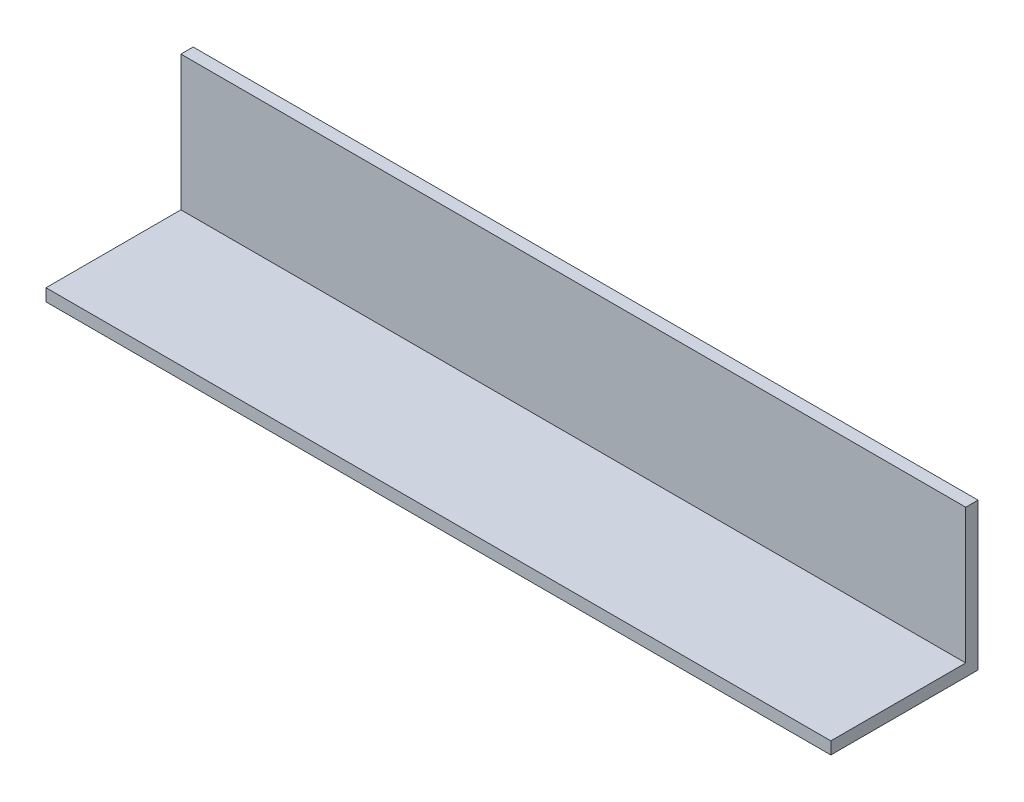
from build123d import *

# Parameters (mm, degrees)
BOSS_EXTRUDE2_DEPTH = 406.4


with BuildPart() as part:
    # Sketch2 → Boss-Extrude2 (new body)
    with BuildSketch(Plane(origin=(0, 0, 0), x_dir=(0, 0, -1), z_dir=(1, 0, 0))):
        Polygon((0, 6.35), (0, 0), (76.2, 0), (76.2, 76.2), (69.85, 76.2), (69.85, 6.35), align=None)
    extrude(amount=BOSS_EXTRUDE2_DEPTH)


solid = part.part
